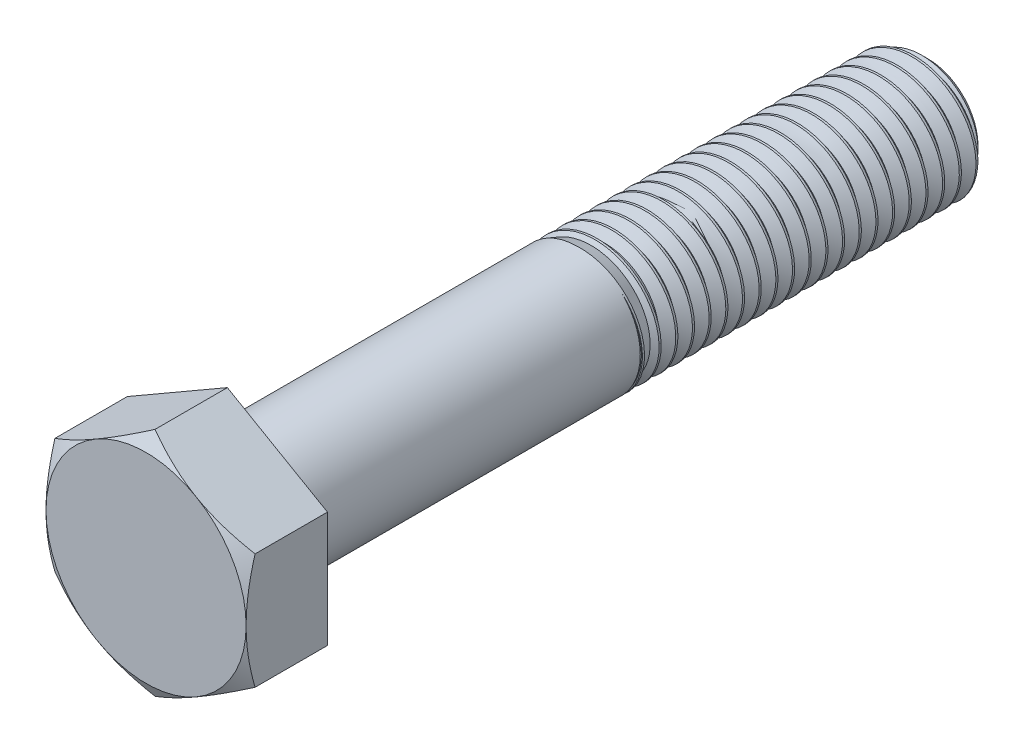
from build123d import *

# Parameters (mm, degrees)
BOSS_EXTRUDE1_DEPTH = 5.159375
SKETCH4_OUTSIDE_W   = 203.924
SKETCH4_OUTSIDE_H   = 205.888
SKETCH4_OUTSIDE_R   = 6.35
CUT_EXTRUDE1_DEPTH  = 51.548747969
CUT_EXTRUDE1_DRAFT  = -60
CUT_SWEEP1_PITCH    = 1.058333333
CUT_SWEEP1_TO       = 22.225


with BuildPart() as part:
    # Sketch2 → Revolve1 (revolve)
    with BuildSketch(Plane(origin=(0, 0, 0), x_dir=(0, 0, -1), z_dir=(1, 0, 0)), mode=Mode.PRIVATE) as revolve1_sk:
        Polygon((-24.8046875, 6.35), (-24.8046875, 0), (24.8046875, 0), (24.8046875, 3.18135), (24.0109375, 3.9751), (-19.6453125, 3.9751), (-19.6453125, 6.35), align=None)
    revolve(revolve1_sk.sketch.rotate(Axis((0, 0, 24.8046875), (0, 0, -1)), 90), axis=Axis((0, 0, 24.8046875), (0, 0, -1)))

    # Sketch3 → Boss-Extrude1 (add)
    with BuildSketch(Plane.XY.offset(24.8046875)):
        Polygon((0, 7.332348419), (-6.35, 3.666174209), (-6.35, -3.666174209), (0, -7.332348419), (6.35, -3.666174209), (6.35, 3.666174209), align=None)
    extrude(amount=-BOSS_EXTRUDE1_DEPTH)


with BuildPart() as cut_extrude1_tool:
    # Sketch4 outside → Cut-Extrude1 (with draft: the straight prism first)
    with BuildSketch(Plane.XY.offset(24.8046875)):
        Rectangle(SKETCH4_OUTSIDE_W, SKETCH4_OUTSIDE_H)
        Circle(SKETCH4_OUTSIDE_R, mode=Mode.SUBTRACT)
    extrude(amount=-CUT_EXTRUDE1_DEPTH)
    # Cut-Extrude1: the draft: its side faces are tilted about the plane it starts from
    cut_extrude1_sides = [cut_extrude1_tool.faces().sort_by_distance(p)[0] for p in [
        (0, -102.944, -0.969686484),
        (101.962, 0, -0.969686484),
        (0, 102.944, -0.969686484),
        (-101.962, 0, -0.969686484),
        (-6.35, 0, -0.969686484),
    ]]
    draft(cut_extrude1_sides, Plane.XY.offset(24.8046875), CUT_EXTRUDE1_DRAFT)


with BuildPart() as part_1:
    add(part.part)

    # Cut-Extrude1: cut by cut_extrude1_tool
    add(cut_extrude1_tool.part, mode=Mode.SUBTRACT)


with BuildPart() as body_2:
    # Split1: the piece on the far side of the plane
    add(part_1.part)
    split(bisect_by=Plane.XY.offset(-2.5796875), keep=Keep.BOTTOM)

    # Cut-Sweep1: arcs per turn and ends read off the stored shape
    # Cut-Sweep1: the profile of Sketch7 screwed along a right-hand helix through 22 turns, 8 arcs to a turn; built about Z, then put on its axis
    cut_sweep1_z = Axis((0, 0, 0), (0, 0, 1))
    cut_sweep1_corners = [(4.032383972, 0, 0.033072917), (3.287692336, 0, -0.396875), (3.287692336, 0, -0.529166667), (4.032383972, 0, -0.959114583)]
    with BuildLine(mode=Mode.PRIVATE) as cut_sweep1_profile:
        Line(cut_sweep1_corners[0], cut_sweep1_corners[1])
        Line(cut_sweep1_corners[1], cut_sweep1_corners[2])
        Line(cut_sweep1_corners[2], cut_sweep1_corners[3])
        Line(cut_sweep1_corners[3], cut_sweep1_corners[0])
    cut_sweep1_cap = Face(cut_sweep1_profile.wire())
    cut_sweep1_turn_angles = [0, 22.5, 45, 67.5, 90, 112.5, 135, 157.5, 180, 202.5, 225, 247.5, 270, 292.5, 315, 337.5, 360]
    cut_sweep1_turn_weights = [1, 0.9238795325112867, 1, 0.9238795325112867, 1, 0.9238795325112867, 1, 0.9238795325112867, 1, 0.9238795325112867, 1, 0.9238795325112867, 1, 0.9238795325112867, 1, 0.9238795325112867, 1]
    cut_sweep1_turn_rails = [Edge.make_bspline([Vector(p[0], p[1], 0).rotate(cut_sweep1_z, cut_sweep1_turn_angles[k]) / cut_sweep1_turn_weights[k] + Vector(0, 0, p[2] + CUT_SWEEP1_PITCH * cut_sweep1_turn_angles[k] / 360) for k in range(17)], [0, 0, 0, 1, 1, 2, 2, 3, 3, 4, 4, 5, 5, 6, 6, 7, 7, 8, 8, 8], 2, cut_sweep1_turn_weights) for p in cut_sweep1_corners]
    cut_sweep1_turn_sides = [Face.make_surface_from_curves(cut_sweep1_turn_rails[p[0]], cut_sweep1_turn_rails[p[1]]) for p in [(0, 1), (1, 2), (2, 3), (3, 0)]]
    cut_sweep1 = Plane(origin=(0, 0, -24.8046875), x_dir=(0, 1, 0), z_dir=(0, 0, 1)) * split(Solid(Shell([*[p.moved(Location((0, 0, CUT_SWEEP1_PITCH * i))) for i in range(22) for p in cut_sweep1_turn_sides], cut_sweep1_cap, cut_sweep1_cap.rotate(cut_sweep1_z, 7920).moved(Location((0, 0, CUT_SWEEP1_PITCH * 7920 / 360)))])), bisect_by=Plane.XY.offset(CUT_SWEEP1_TO), keep=Keep.BOTTOM, mode=Mode.PRIVATE)
    add(cut_sweep1, mode=Mode.SUBTRACT)


with BuildPart() as part_2:
    add(part_1.part)

    # Split1
    split(bisect_by=Plane.XY.offset(-2.5796875), keep=Keep.TOP)

    add(body_2.part)  # Boss-Extrude2 merges body 2
    # Boss-Extrude2: read off the stored shape, not the designer's step
    # Boss-Extrude2 outline → Boss-Extrude2 (revolve)
    with BuildSketch(Plane.XZ):
        Polygon((3.287690901, -2.5796875), (3.287690901, -4.468328477), (3.9751, -2.5796875), align=None)
    revolve(axis=Axis((0, 0, 0), (0, 0, 1)))


solid = part_2.part
